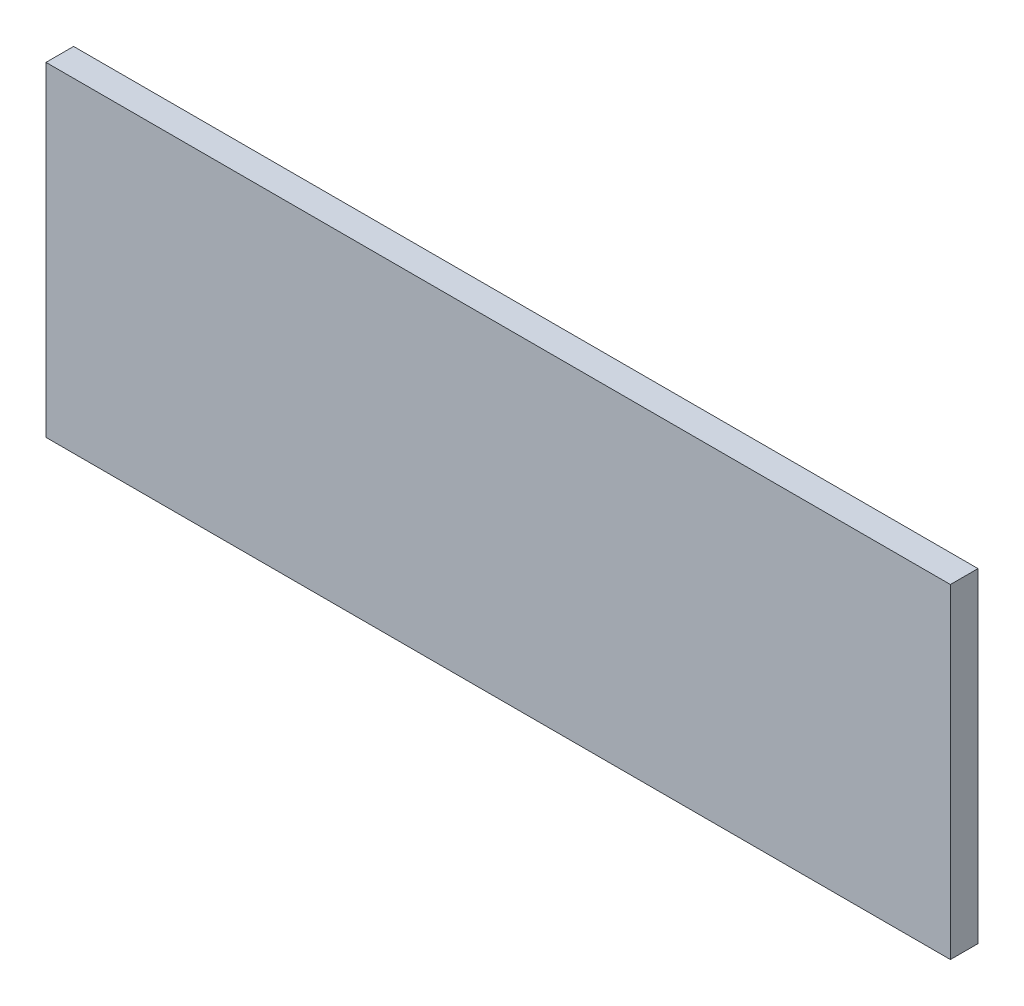
from build123d import *

# Parameters (mm, degrees)
SKETCH_1_W      = 426
SKETCH_1_H      = 153
EXTRUDE_1_DEPTH = 13


with BuildPart() as part:
    # ｽｹｯﾁ1 → ﾎﾞｽ - 押し出し1 (new body)
    with BuildSketch(Plane.XY):
        with Locations((143.719868277, 85.007142857)):
            Rectangle(SKETCH_1_W, SKETCH_1_H)
    extrude(amount=EXTRUDE_1_DEPTH)


solid = part.part
